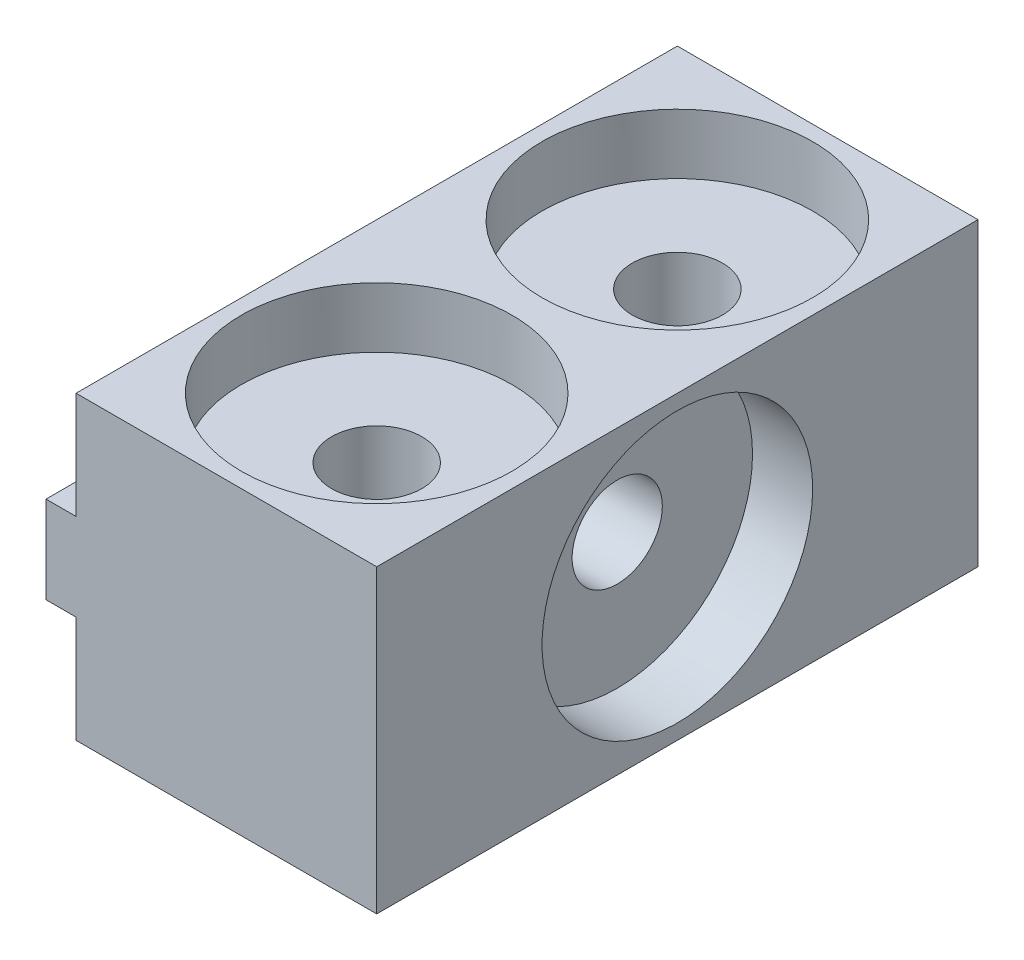
from build123d import *

# Parameters (mm, degrees)
BOSS_EXTRUDE1_DEPTH = 20
SKETCH2_R           = 1.5
CUT_EXTRUDE1_DEPTH  = 25.919871589
SKETCH3_R           = 4.5
CUT_EXTRUDE2_DEPTH  = 2
SKETCH4_R           = 1.5
CUT_EXTRUDE3_DEPTH  = 25.103941586
SKETCH6_R           = 4.5
CUT_EXTRUDE4_DEPTH  = 2
LPATTERN1_COUNT     = 2
LPATTERN1_PITCH     = 10


with BuildPart() as part:
    # Sketch1 → Boss-Extrude1 (new body)
    with BuildSketch(Plane.XY):
        Polygon((-10, 0), (-10, -3.55), (-11, -3.55), (-11, -6.45), (-10, -6.45), (-10, -10), (0, -10), (0, 0), align=None)
    extrude(amount=BOSS_EXTRUDE1_DEPTH)

    # Sketch2 → Cut-Extrude1 (cut, through all)
    with BuildSketch(Plane(origin=(0, 0, 0), x_dir=(1, 0, 0), z_dir=(0, 1, 0))):
        with Locations((-5, -15)):
            Circle(SKETCH2_R)
    cut_extrude1 = extrude(amount=-CUT_EXTRUDE1_DEPTH, mode=Mode.SUBTRACT)

    # Sketch3 → Cut-Extrude2 (cut)
    with BuildSketch(Plane(origin=(0, 0, 0), x_dir=(0, 0, -1), z_dir=(1, 0, 0))):
        with Locations((-10, -5)):
            Circle(SKETCH3_R)
    extrude(amount=-CUT_EXTRUDE2_DEPTH, mode=Mode.SUBTRACT)

    # Sketch4 → Cut-Extrude3 (cut, through all)
    with BuildSketch(Plane(origin=(-2, 0, 0), x_dir=(0, 0, -1), z_dir=(1, 0, 0))):
        with Locations((-10, -5)):
            Circle(SKETCH4_R)
    extrude(amount=-CUT_EXTRUDE3_DEPTH, mode=Mode.SUBTRACT)

    # Sketch6 → Cut-Extrude4 (cut)
    with BuildSketch(Plane(origin=(0, 0, 0), x_dir=(1, 0, 0), z_dir=(0, 1, 0))):
        with Locations((-5, -15)):
            Circle(SKETCH6_R)
    cut_extrude4 = extrude(amount=-CUT_EXTRUDE4_DEPTH, mode=Mode.SUBTRACT)

    # LPattern1: Cut-Extrude1, Cut-Extrude4 ×2
    with Locations(*[(0, 0, -i * LPATTERN1_PITCH) for i in range(1, LPATTERN1_COUNT)]):
        add(cut_extrude1, mode=Mode.SUBTRACT)
        add(cut_extrude4, mode=Mode.SUBTRACT)


solid = part.part
